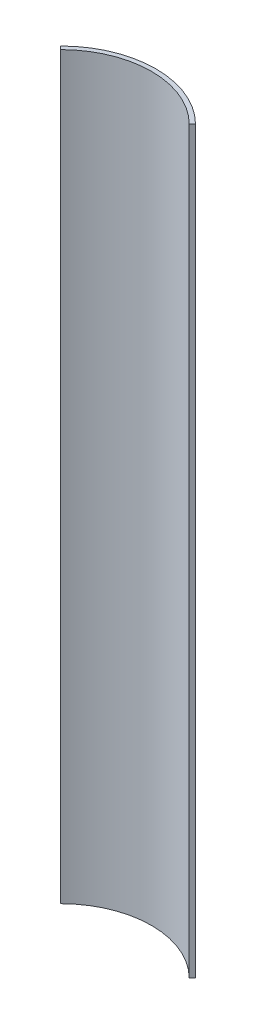
from build123d import *

# Parameters (mm, degrees)
SKETCH1_W          = 3
SKETCH1_H          = 503.85181098
SKETCH6_OUTSIDE_W  = 239.27
SKETCH6_OUTSIDE_H  = 239.27
CUT_EXTRUDE2_DEPTH = 513.168573253


with BuildPart() as part:
    # Sketch1 → Revolve1 (revolve)
    with BuildSketch(Plane.XY):
        with Locations((63.5, 0)):
            Rectangle(SKETCH1_W, SKETCH1_H)
    revolve(axis=Axis((0, 0, 0), (0, 1, 0)))

    # Sketch6 outside → Cut-Extrude2 (cut, through all)
    with BuildSketch(Plane(origin=(0, 251.92590549, 0), x_dir=(1, 0, 0), z_dir=(0, 1, 0))):
        Rectangle(SKETCH6_OUTSIDE_W, SKETCH6_OUTSIDE_H)
        with BuildLine():
            Line((0, 0), (-45.961940777, 45.961940777))
            ThreePointArc((-45.961940777, 45.961940777), (0, 65), (45.961940777, 45.961940777))
            Line((45.961940777, 45.961940777), (0, 0))
        make_face(mode=Mode.SUBTRACT)
    extrude(amount=-CUT_EXTRUDE2_DEPTH, mode=Mode.SUBTRACT)


solid = part.part
